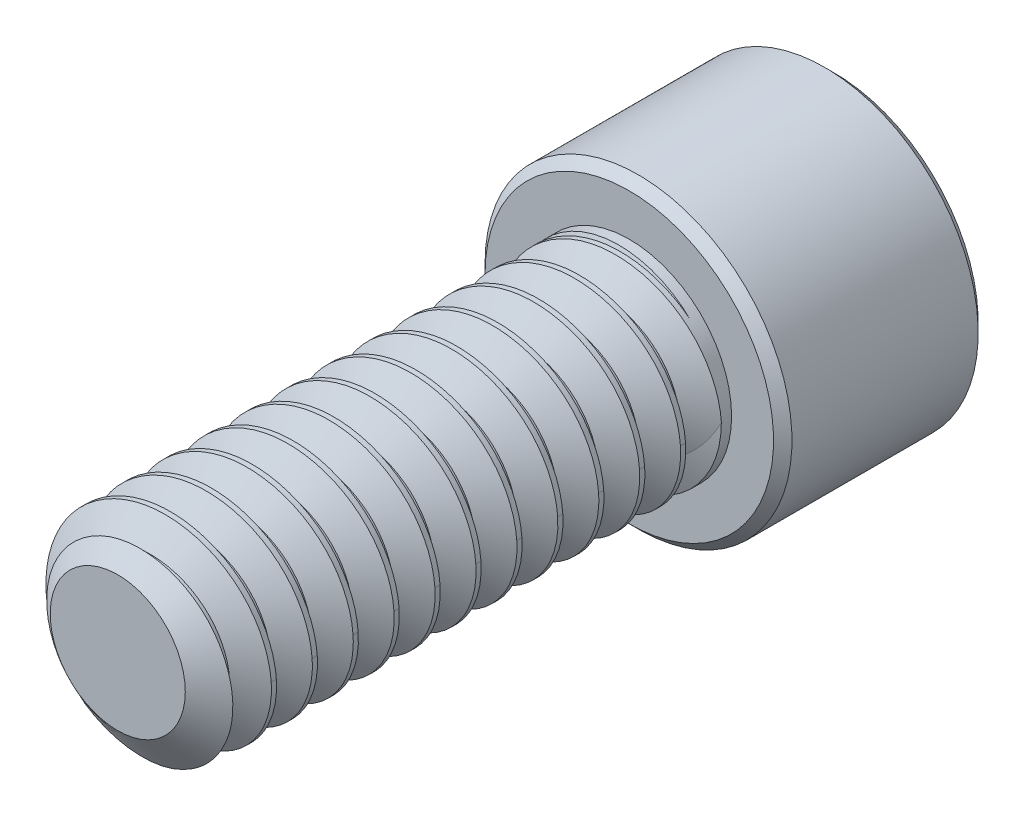
from build123d import *

# Parameters (mm, degrees)
SKETCH1_R          = 3.175
EXTRUDE1_DEPTH     = 15.875
CUT_SWEEP1_PITCH   = 1.27
SKETCH6_R          = 4.7625
EXTRUDE2_DEPTH     = 6.35
CUT_EXTRUDE1_DEPTH = 3.571875
CHAMFER1_SIZE      = 0.28575


with BuildPart() as part:
    # Sketch1 → Extrude1 (new body)
    with BuildSketch(Plane.XY):
        Circle(SKETCH1_R)
    extrude(amount=-EXTRUDE1_DEPTH)

    # Cut-Sweep1: the profile of Sketch3 profile screwed along a right-hand helix of 13.5 turns, 6 arcs to a turn; built about Z, then put on its axis
    cut_sweep1_z = Axis((0, 0, 0), (0, 0, 1))
    cut_sweep1_corners = [(3.1753, 0, -1.111423205), (2.350110803, 0, -0.635), (2.350110803, 0, -0.47625), (3.1753, 0, 0.000173205)]
    with BuildLine(mode=Mode.PRIVATE) as cut_sweep1_profile:
        Line(cut_sweep1_corners[0], cut_sweep1_corners[1])
        Line(cut_sweep1_corners[1], cut_sweep1_corners[2])
        Line(cut_sweep1_corners[2], cut_sweep1_corners[3])
        Line(cut_sweep1_corners[3], cut_sweep1_corners[0])
    cut_sweep1_cap = Face(cut_sweep1_profile.wire())
    cut_sweep1_turn_angles = [0, 30, 60, 90, 120, 150, 180, 210, 240, 270, 300, 330, 360]
    cut_sweep1_turn_weights = [1, 0.8660254037844387, 1, 0.8660254037844387, 1, 0.8660254037844387, 1, 0.8660254037844387, 1, 0.8660254037844387, 1, 0.8660254037844387, 1]
    cut_sweep1_turn_rails = [Edge.make_bspline([Vector(p[0], p[1], 0).rotate(cut_sweep1_z, cut_sweep1_turn_angles[k]) / cut_sweep1_turn_weights[k] + Vector(0, 0, p[2] + CUT_SWEEP1_PITCH * cut_sweep1_turn_angles[k] / 360) for k in range(13)], [0, 0, 0, 1, 1, 2, 2, 3, 3, 4, 4, 5, 5, 6, 6, 6], 2, cut_sweep1_turn_weights) for p in cut_sweep1_corners]
    cut_sweep1_turn_sides = [Face.make_surface_from_curves(cut_sweep1_turn_rails[p[0]], cut_sweep1_turn_rails[p[1]]) for p in [(0, 1), (1, 2), (2, 3), (3, 0)]]
    cut_sweep1_last_angles = [4680, 4710, 4740, 4770, 4800, 4830, 4860]
    cut_sweep1_last_weights = [1, 0.8660254037844387, 1, 0.8660254037844387, 1, 0.8660254037843712, 1]
    cut_sweep1_last_rails = [Edge.make_bspline([Vector(p[0], p[1], 0).rotate(cut_sweep1_z, cut_sweep1_last_angles[k]) / cut_sweep1_last_weights[k] + Vector(0, 0, p[2] + CUT_SWEEP1_PITCH * cut_sweep1_last_angles[k] / 360) for k in range(7)], [0, 0, 0, 1, 1, 2, 2, 3, 3, 3], 2, cut_sweep1_last_weights) for p in cut_sweep1_corners]
    cut_sweep1_last_sides = [Face.make_surface_from_curves(cut_sweep1_last_rails[p[0]], cut_sweep1_last_rails[p[1]]) for p in [(0, 1), (1, 2), (2, 3), (3, 0)]]
    cut_sweep1 = Plane(origin=(0, 0, 0), x_dir=(0, 1, 0), z_dir=(0, 0, -1)) * Solid(Shell([*[p.moved(Location((0, 0, CUT_SWEEP1_PITCH * i))) for i in range(13) for p in cut_sweep1_turn_sides], *cut_sweep1_last_sides, cut_sweep1_cap, cut_sweep1_cap.rotate(cut_sweep1_z, 4860).moved(Location((0, 0, CUT_SWEEP1_PITCH * 4860 / 360)))]))
    add(cut_sweep1, mode=Mode.SUBTRACT)

    # Sketch4 → Cut-Revolve1 (revolve, cut)
    with BuildSketch(Plane(origin=(0, 0, 0), x_dir=(0, 0, -1), z_dir=(1, 0, 0)), mode=Mode.PRIVATE) as cut_revolve1_sk:
        Polygon((0.755446349, 3.175), (0, 2.096110803), (0, 3.175), align=None)
    revolve(cut_revolve1_sk.sketch.rotate(Axis((0, 0, 0), (0, 0, -1)), 229.892048011), axis=Axis((0, 0, 0), (0, 0, -1)), mode=Mode.SUBTRACT)

    # Sketch6 → Extrude2 (add)
    with BuildSketch(Plane(origin=(0, 0, -15.875), x_dir=(-1, 0, 0), z_dir=(0, 0, -1))):
        Circle(SKETCH6_R)
    extrude(amount=EXTRUDE2_DEPTH)

    # Sketch7 → Cut-Extrude1 (cut)
    with BuildSketch(Plane(origin=(0, 0, -22.225), x_dir=(-1, 0, 0), z_dir=(0, 0, -1))):
        Polygon((0, 2.749630657), (-2.38125, 1.374815329), (-2.38125, -1.374815329), (0, -2.749630657), (2.38125, -1.374815329), (2.38125, 1.374815329), align=None)
    extrude(amount=-CUT_EXTRUDE1_DEPTH, mode=Mode.SUBTRACT)

    # Cut-Extrude2 cone 1 section (through the dimple's axis) → Cut-Extrude2 (revolve, cut)
    with BuildSketch(Plane(origin=(0, 0, -22.225), x_dir=(0, 1, 0), z_dir=(1, 0, 0))):
        Polygon((0, 0), (2.749630657, 0), (0, 2.749630657), align=None)
    revolve(axis=Axis((0, 0, -22.225), (0, 0, 1)), mode=Mode.SUBTRACT)

    # Chamfer1
    chamfer1_edges = [part.edges().sort_by_distance(p)[0] for p in [
        (4.7625, 0, -15.875),
        (4.7625, 0, -22.225),
    ]]
    chamfer(chamfer1_edges, length=CHAMFER1_SIZE)

    # Sketch10 → Revolve1 (revolve)
    with BuildSketch(Plane(origin=(0, 0, 0), x_dir=(0, 0, -1), z_dir=(1, 0, 0)), mode=Mode.PRIVATE) as revolve1_sk:
        Polygon((15.875, 3.175), (15.875, 0), (14.242371939, 0), (15.5575, 3.175), align=None)
    revolve(revolve1_sk.sketch.rotate(Axis((0, 0, -15.875), (0, 0, 1)), 270), axis=Axis((0, 0, -15.875), (0, 0, 1)))


solid = part.part
